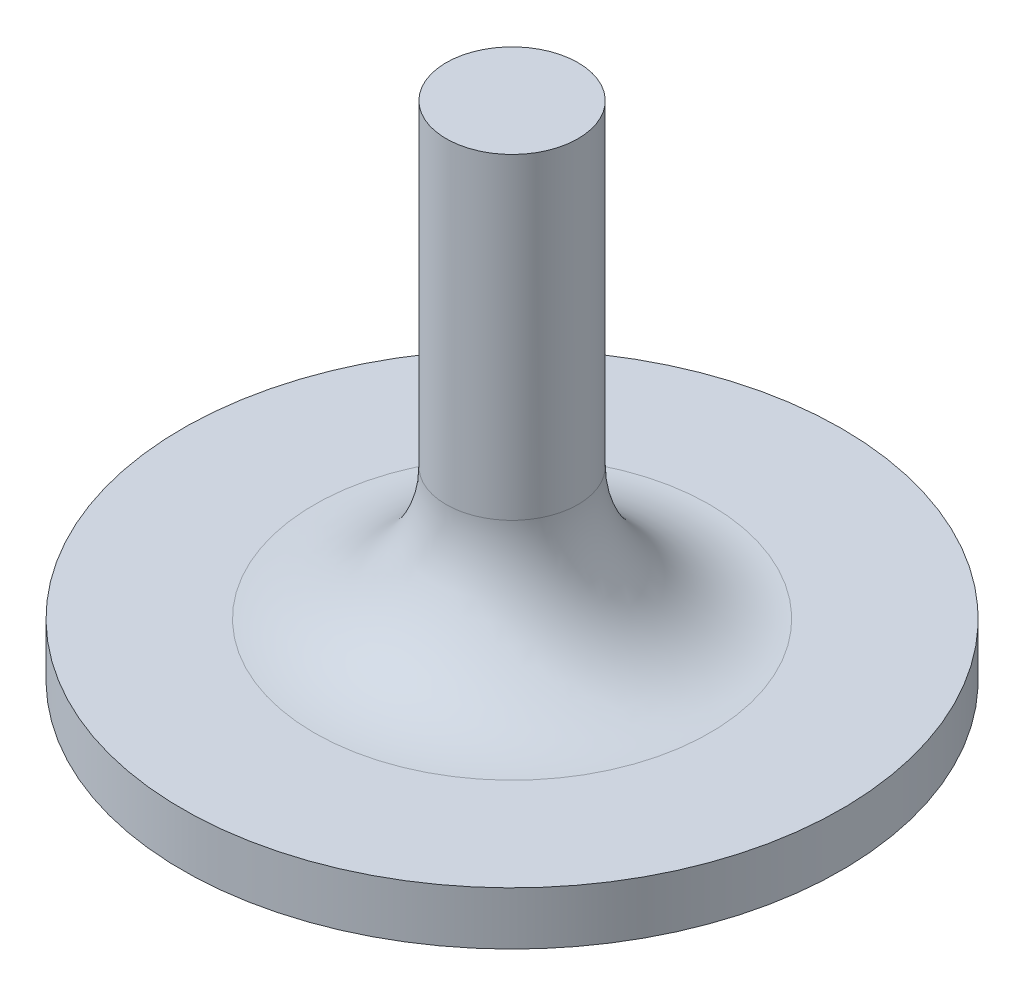
from build123d import *

# Parameters (mm, degrees)
FILLET1_R  = 25
FILLET12_R = 10


with BuildPart() as part:
    # Sketch1 → Revolve1 (revolve)
    with BuildSketch(Plane(origin=(0, 0, 0), x_dir=(0, 0, -1), z_dir=(1, 0, 0))):
        Polygon((0, 0), (5, 10.722534603), (5, 11.94189357), (25, 11.94189357), (25, 15.964993567), (5, 15.964993567), (5, 50), (0, 50), align=None)
    revolve(axis=Axis((0, 0, 0), (0, 1, 0)))

    # Fillet1
    # the kernel refuses this fillet: 25 mm, written as the material it adds along each edge
    with BuildSketch(Plane(origin=(0, 11.94189357, 0), x_dir=(0, 0, -1), z_dir=(1, 0, 0))) as fillet1_piece_1:
        with BuildLine():
            CenterArc((12.712399892, -25), FILLET1_R, 90, 17.968615565)
            Line((12.712399892, 0), (12.712399892, 0.5))
            Line((12.712399892, 0.5), (5, 0.5))
            Line((5, 0.5), (4.5, 0))
            ThreePointArc((4.5, 0), (4.5, -0.609679484), (4.845752002, -0.743746147))
            Line((4.845752002, -0.743746147), (5, -1.219358968))
        make_face()
    revolve(axis=Axis((0, 11.94189357, 0), (0, 1, 0)))

    # Fillet12
    fillet12_edges = [part.edges().sort_by_distance(p)[0] for p in [
        (0, 15.964993567, 5),
    ]]
    fillet(fillet12_edges, radius=FILLET12_R)


solid = part.part
